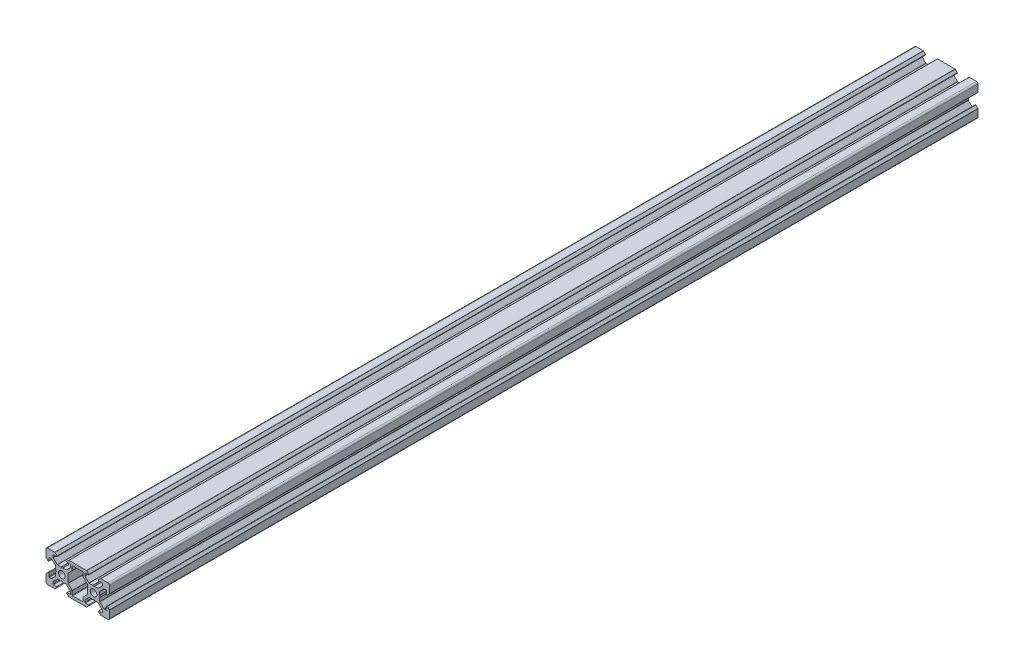
from build123d import *

# Parameters (mm, degrees)
SKETCH_1_R      = 2.1
EXTRUDE_1_DEPTH = 548
FILLET_1_R      = 1
FILLET_2_R      = 0.3


with BuildPart() as part:
    # Эскиз1 → Бобышка-Вытянуть1 (new body)
    with BuildSketch(Plane.XY):
        Polygon((-10, -10), (-10, -4.4), (-8.2, -2.6), (-8.2, -5.499339828), (-6.56, -5.499339828), (-3.900660172, -2.84), (-3.900660172, -0.5), (-3.400660172, 0), (-3.900660172, 0.5), (-3.900660172, 2.84), (-6.56, 5.499339828), (-8.2, 5.499339828), (-8.2, 2.6), (-10, 4.4), (-10, 10), (-4.4, 10), (-2.6, 8.2), (-5.499339828, 8.2), (-5.499339828, 6.56), (-2.84, 3.900660172), (-0.5, 3.900660172), (0, 3.400660172), (0.5, 3.900660172), (2.84, 3.900660172), (5.499339828, 6.56), (5.499339828, 8.2), (2.6, 8.2), (4.4, 10), (15.6, 10), (17.4, 8.2), (14.500660172, 8.2), (14.500660172, 6.56), (17.16, 3.900660172), (19.5, 3.900660172), (20, 3.400660172), (20.5, 3.900660172), (22.84, 3.900660172), (25.499339828, 6.56), (25.499339828, 8.2), (22.6, 8.2), (24.4, 10), (30, 10), (30, 4.4), (28.2, 2.6), (28.2, 5.499339828), (26.56, 5.499339828), (23.900660172, 2.84), (23.900660172, 0.5), (23.400660172, 0), (23.900660172, -0.5), (23.900660172, -2.84), (26.56, -5.499339828), (28.2, -5.499339828), (28.2, -2.6), (30, -4.4), (30, -10), (24.4, -10), (22.6, -8.2), (25.499339828, -8.2), (25.499339828, -6.56), (22.84, -3.900660172), (20.5, -3.900660172), (20, -3.400660172), (19.5, -3.900660172), (17.16, -3.900660172), (14.500660172, -6.56), (14.500660172, -8.2), (17.4, -8.2), (15.6, -10), (4.4, -10), (2.6, -8.2), (5.499339828, -8.2), (5.499339828, -6.56), (2.84, -3.900660172), (0.5, -3.900660172), (0, -3.400660172), (-0.5, -3.900660172), (-2.84, -3.900660172), (-5.499339828, -6.56), (-5.499339828, -8.2), (-2.6, -8.2), (-4.4, -10), align=None)
        Circle(SKETCH_1_R, mode=Mode.SUBTRACT)
        with Locations((20, 0)):
            Circle(SKETCH_1_R, mode=Mode.SUBTRACT)
        Polygon((3.900660172, -0.5), (3.900660172, 0.5), (3.900660172, 2.84), (6.56, 5.499339828), (6.56, 8.2), (13.44, 8.2), (13.44, 5.499339828), (16.099339828, 2.84), (16.099339828, 0.5), (16.099339828, -0.5), (16.099339828, -2.84), (13.44, -5.499339828), (13.44, -8.2), (6.56, -8.2), (6.56, -5.499339828), (3.900660172, -2.84), align=None, mode=Mode.SUBTRACT)
    extrude(amount=EXTRUDE_1_DEPTH)

    # Скругление1
    fillet_1_edges = [part.edges().sort_by_distance(p)[0] for p in [
        (-10, 10, 274),
        (-10, -10, 274),
        (30, 10, 274),
        (30, -10, 274),
    ]]
    fillet(fillet_1_edges, radius=FILLET_1_R)

    # Скругление2
    fillet_2_edges = [part.edges().sort_by_distance(p)[0] for p in [
        (-4.4, 10, 274),
        (-2.6, 8.2, 274),
        (-5.499339828, 8.2, 274),
        (-5.499339828, 6.56, 274),
        (-2.84, 3.900660172, 274),
        (-0.5, 3.900660172, 274),
        (0.5, 3.900660172, 274),
        (2.84, 3.900660172, 274),
        (5.499339828, 6.56, 274),
        (4.4, 10, 274),
        (5.499339828, 8.2, 274),
        (2.6, 8.2, 274),
        (3.900660172, 2.84, 274),
        (3.900660172, -2.84, 274),
        (4.4, -10, 274),
        (2.6, -8.2, 274),
        (5.499339828, -8.2, 274),
        (5.499339828, -6.56, 274),
        (2.84, -3.900660172, 274),
        (0.5, -3.900660172, 274),
        (-0.5, -3.900660172, 274),
        (-2.84, -3.900660172, 274),
        (-5.499339828, -6.56, 274),
        (-5.499339828, -8.2, 274),
        (-2.6, -8.2, 274),
        (-10, -4.4, 274),
        (-8.2, -2.6, 274),
        (-8.2, -5.499339828, 274),
        (-6.56, -5.499339828, 274),
        (-3.900660172, -2.84, 274),
        (-3.900660172, -0.5, 274),
        (-3.900660172, 0.5, 274),
        (-3.900660172, 2.84, 274),
        (-6.56, 5.499339828, 274),
        (-8.2, 5.499339828, 274),
        (-8.2, 2.6, 274),
        (-10, 4.4, 274),
        (6.56, -5.499339828, 274),
        (6.56, 5.499339828, 274),
        (6.56, 8.2, 274),
        (13.44, 8.2, 274),
        (13.44, 5.499339828, 274),
        (16.099339828, 2.84, 274),
        (16.099339828, -2.84, 274),
        (13.44, -5.499339828, 274),
        (13.44, -8.2, 274),
        (6.56, -8.2, 274),
        (15.6, 10, 274),
        (17.4, 8.2, 274),
        (14.500660172, 8.2, 274),
        (14.500660172, 6.56, 274),
        (17.16, 3.900660172, 274),
        (19.5, 3.900660172, 274),
        (20.5, 3.900660172, 274),
        (22.84, 3.900660172, 274),
        (25.499339828, 6.56, 274),
        (25.499339828, 8.2, 274),
        (22.6, 8.2, 274),
        (24.4, 10, 274),
        (30, 4.4, 274),
        (28.2, 2.6, 274),
        (28.2, 5.499339828, 274),
        (26.56, 5.499339828, 274),
        (23.900660172, 2.84, 274),
        (23.900660172, 0.5, 274),
        (23.900660172, -0.5, 274),
        (23.900660172, -2.84, 274),
        (26.56, -5.499339828, 274),
        (28.2, -5.499339828, 274),
        (28.2, -2.6, 274),
        (30, -4.4, 274),
        (24.4, -10, 274),
        (22.6, -8.2, 274),
        (25.499339828, -8.2, 274),
        (25.499339828, -6.56, 274),
        (22.84, -3.900660172, 274),
        (20.5, -3.900660172, 274),
        (19.5, -3.900660172, 274),
        (17.16, -3.900660172, 274),
        (14.500660172, -6.56, 274),
        (14.500660172, -8.2, 274),
        (17.4, -8.2, 274),
        (15.6, -10, 274),
    ]]
    fillet(fillet_2_edges, radius=FILLET_2_R)


solid = part.part
